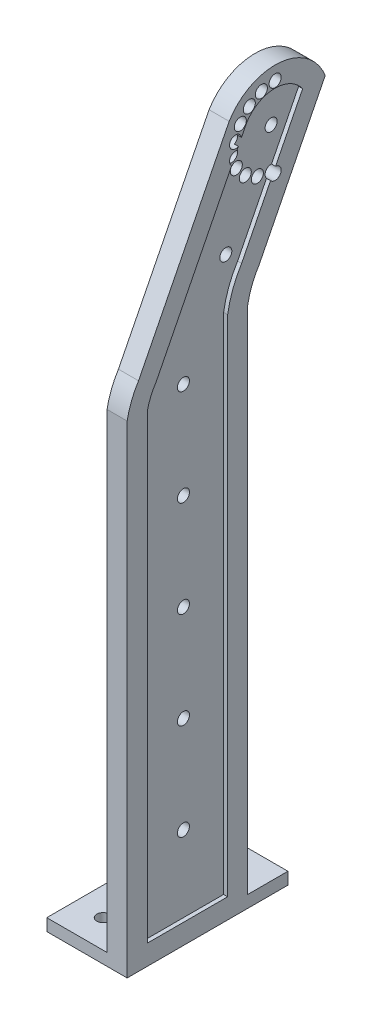
from build123d import *

# Parameters (mm, degrees)
SKETCH_1_R          = 1.5
EXTRUDE_2_DEPTH     = 5
CUT_EXTRUDE_1_DEPTH = 1
SKETCH_5_W          = 20
SKETCH_5_H          = 40
EXTRUDE_3_DEPTH     = 3
SKETCH_6_R          = 1.55
CUT_EXTRUDE_2_DEPTH = 10


with BuildPart() as part:
    # 草图1 → 凸台-拉伸2 (new body)
    with BuildSketch(Plane(origin=(0, 0, 0), x_dir=(0, 0, -1), z_dir=(1, 0, 0))):
        with BuildLine():
            Line((-15, 0), (15, 0))
            Line((15, 0), (15, 130))
            ThreePointArc((15, 130), (16.060667235, 133.763397528), (17.833287426, 137.248507798))
            Line((17.833287426, 137.248507798), (34.277601095, 169.80605943))
            ThreePointArc((34.277601095, 169.80605943), (22.969406924, 178.256928012), (10.37531975, 171.878730504))
            Line((10.37531975, 171.878730504), (-12.166712574, 127.248507798))
            ThreePointArc((-12.166712574, 127.248507798), (-13.939332765, 123.763397528), (-15, 120))
            Line((-15, 120), (-15, 0))
        make_face()
        with Locations((0, 23.934052351)):
            Circle(SKETCH_1_R, mode=Mode.SUBTRACT)
        with Locations((0, 47.934052351)):
            Circle(SKETCH_1_R, mode=Mode.SUBTRACT)
        with Locations((0, 71.934052351)):
            Circle(SKETCH_1_R, mode=Mode.SUBTRACT)
        with Locations((0, 95.934052351)):
            Circle(SKETCH_1_R, mode=Mode.SUBTRACT)
        with Locations((10.541707006, 142.602806473)):
            Circle(SKETCH_1_R, mode=Mode.SUBTRACT)
        with Locations((0, 119.934052351)):
            Circle(SKETCH_1_R, mode=Mode.SUBTRACT)
        with Locations((21.812723168, 164.917917825)):
            Circle(SKETCH_1_R, mode=Mode.SUBTRACT)
        with Locations((11.964645637, 166.654399602)):
            Circle(SKETCH_1_R, mode=Mode.SUBTRACT)
        with Locations((11.964645637, 163.181436049)):
            Circle(SKETCH_1_R, mode=Mode.SUBTRACT)
        with Locations((13.15246913, 159.917917825)):
            Circle(SKETCH_1_R, mode=Mode.SUBTRACT)
        with Locations((15.384847071, 157.257473394)):
            Circle(SKETCH_1_R, mode=Mode.SUBTRACT)
        with Locations((18.392521734, 155.520991617)):
            Circle(SKETCH_1_R, mode=Mode.SUBTRACT)
        with Locations((21.812723168, 154.917917825)):
            Circle(SKETCH_1_R, mode=Mode.SUBTRACT)
        with Locations((13.15246913, 169.917917825)):
            Circle(SKETCH_1_R, mode=Mode.SUBTRACT)
        with Locations((15.384847071, 172.578362256)):
            Circle(SKETCH_1_R, mode=Mode.SUBTRACT)
        with Locations((18.392521734, 174.314844033)):
            Circle(SKETCH_1_R, mode=Mode.SUBTRACT)
        with Locations((21.812723168, 174.917917825)):
            Circle(SKETCH_1_R, mode=Mode.SUBTRACT)
    extrude(amount=-EXTRUDE_2_DEPTH)

    # 草图4 → 切除-拉伸1 (cut)
    with BuildSketch(Plane(origin=(0, 0, 0), x_dir=(0, 0, -1), z_dir=(1, 0, 0))):
        with BuildLine():
            Line((-10, 5), (10, 5))
            Line((10, 5), (10, 130.418298195))
            ThreePointArc((10, 130.418298195), (11.272736422, 135.241025308), (13.477541954, 139.715104809))
            Line((13.477541954, 139.715104809), (28.657153069, 169.768713769))
            ThreePointArc((28.657153069, 169.768713769), (21.607154469, 173.304465594), (14.73885303, 169.427552317))
            Line((14.73885303, 169.427552317), (-7.82549521, 124.753147068))
            ThreePointArc((-7.82549521, 124.753147068), (-9.161705076, 122.242477333), (-10, 119.524724411))
            Line((-10, 119.524724411), (-10, 5))
        make_face()
    extrude(amount=-CUT_EXTRUDE_1_DEPTH, mode=Mode.SUBTRACT)

    # 草图5 → 凸台-拉伸3 (add)
    with BuildSketch(Plane(origin=(0, 0, 0), x_dir=(-1, 0, 0), z_dir=(0, -1, 0))):
        with Locations((10, 5)):
            Rectangle(SKETCH_5_W, SKETCH_5_H)
    extrude(amount=-EXTRUDE_3_DEPTH)

    # 草图6 → 切除-拉伸2 (cut)
    with BuildSketch(Plane.XZ):
        with Locations((-13, -18)):
            Circle(SKETCH_6_R)
        with Locations((-13, 8)):
            Circle(SKETCH_6_R)
    extrude(amount=-CUT_EXTRUDE_2_DEPTH, mode=Mode.SUBTRACT)


solid = part.part
